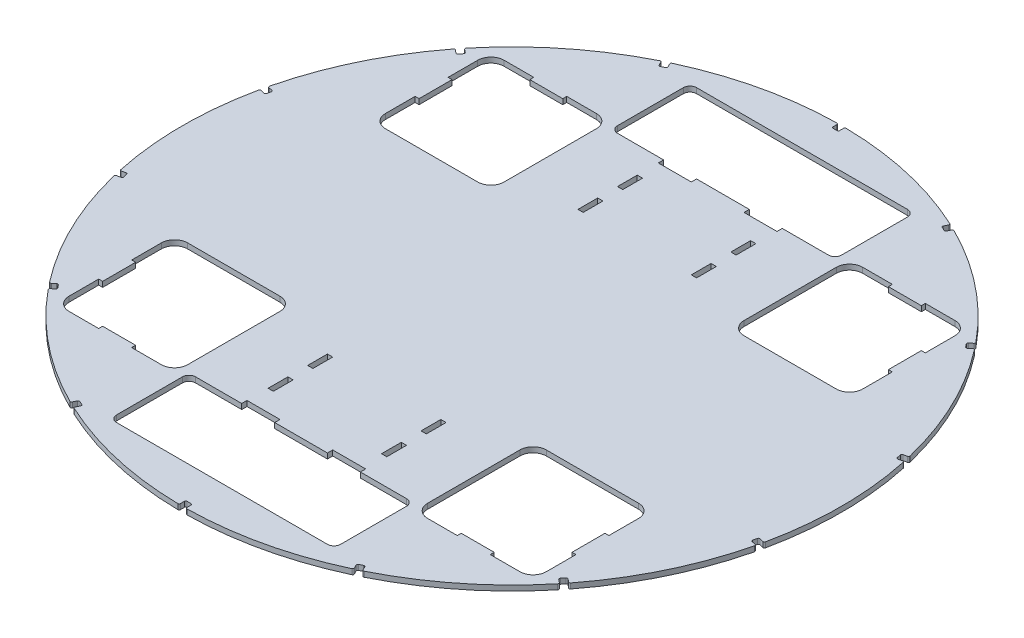
from build123d import *

# Parameters (mm, degrees)
SKETCH1_R                = 250
BOSS_EXTRUDE1_DEPTH      = 4
CUT_EXTRUDE1_DEPTH       = 10
SKETCH3_W                = 25
SKETCH3_H                = 4
CUT_EXTRUDE2_DEPTH       = 5
SKETCH4_W                = 4
SKETCH4_H                = 15
CUT_EXTRUDE3_DEPTH       = 20
CUT_EXTRUDE4_DEPTH       = 5
SKETCH8_W                = 6
SKETCH8_H                = 25
SKETCH8_W_2              = 25
SKETCH8_H_2              = 6
BOSS_EXTRUDE2_DEPTH      = 4
CUT_EXTRUDE5_DEPTH       = 4
FILLET1_R                = 1
CIRPATTERN1_COUNT        = 14
FILLET1_OF_CIRPATTERN1_R = 1


with BuildPart() as part:
    # Sketch1 → Boss-Extrude1 (new body)
    with BuildSketch(Plane(origin=(0, 0, 0), x_dir=(1, 0, 0), z_dir=(0, 1, 0))):
        Circle(SKETCH1_R)
    extrude(amount=BOSS_EXTRUDE1_DEPTH)

    # Sketch2 → Cut-Extrude1 (cut)
    with BuildSketch(Plane(origin=(0, 4, 0), x_dir=(1, 0, 0), z_dir=(0, 1, 0))):
        with BuildLine():
            Line((80, 220), (-80, 220))
            ThreePointArc((-80, 220), (-83.535533906, 218.535533906), (-85, 215))
            Line((-85, 215), (-85, 165))
            ThreePointArc((-85, 165), (-83.535533906, 161.464466094), (-80, 160))
            Line((-80, 160), (80, 160))
            ThreePointArc((80, 160), (83.535533906, 161.464466094), (85, 165))
            Line((85, 165), (85, 215))
            ThreePointArc((85, 215), (83.535533906, 218.535533906), (80, 220))
        make_face()
        with BuildLine():
            Line((85, -215), (85, -165))
            ThreePointArc((85, -165), (83.535533906, -161.464466094), (80, -160))
            Line((80, -160), (-80, -160))
            ThreePointArc((-80, -160), (-83.535533906, -161.464466094), (-85, -165))
            Line((-85, -165), (-85, -215))
            ThreePointArc((-85, -215), (-83.535533906, -218.535533906), (-80, -220))
            Line((-80, -220), (80, -220))
            ThreePointArc((80, -220), (83.535533906, -218.535533906), (85, -215))
        make_face()
    extrude(amount=-CUT_EXTRUDE1_DEPTH, mode=Mode.SUBTRACT)

    # Sketch3 → Cut-Extrude2 (cut)
    with BuildSketch(Plane(origin=(0, 4, 0), x_dir=(1, 0, 0), z_dir=(0, 1, 0))):
        with Locations((32.5, 158)):
            Rectangle(SKETCH3_W, SKETCH3_H)
        with Locations((-32.5, 158)):
            Rectangle(SKETCH3_W, SKETCH3_H)
        with Locations((-32.5, -158)):
            Rectangle(SKETCH3_W, SKETCH3_H)
        with Locations((32.5, -158)):
            Rectangle(SKETCH3_W, SKETCH3_H)
    extrude(amount=-CUT_EXTRUDE2_DEPTH, mode=Mode.SUBTRACT)

    # Sketch4 → Cut-Extrude3 (cut)
    with BuildSketch(Plane(origin=(0, 4, 0), x_dir=(1, 0, 0), z_dir=(0, 1, 0))):
        with Locations((43, 132.5)):
            Rectangle(SKETCH4_W, SKETCH4_H)
        with Locations((43, 102.5)):
            Rectangle(SKETCH4_W, SKETCH4_H)
        with Locations((-43, 102.5)):
            Rectangle(SKETCH4_W, SKETCH4_H)
        with Locations((-43, 132.5)):
            Rectangle(SKETCH4_W, SKETCH4_H)
        with Locations((-43, -132.5)):
            Rectangle(SKETCH4_W, SKETCH4_H)
        with Locations((-43, -102.5)):
            Rectangle(SKETCH4_W, SKETCH4_H)
        with Locations((43, -102.5)):
            Rectangle(SKETCH4_W, SKETCH4_H)
        with Locations((43, -132.5)):
            Rectangle(SKETCH4_W, SKETCH4_H)
    extrude(amount=-CUT_EXTRUDE3_DEPTH, mode=Mode.SUBTRACT)

    # Sketch7 → Cut-Extrude4 (cut)
    with BuildSketch(Plane(origin=(0, 4, 0), x_dir=(1, 0, 0), z_dir=(0, 1, 0))):
        with BuildLine():
            Line((-101, 75), (-171, 75))
            ThreePointArc((-171, 75), (-178.071067812, 77.928932188), (-181, 85))
            Line((-181, 85), (-181, 155))
            ThreePointArc((-181, 155), (-178.071067812, 162.071067812), (-171, 165))
            Line((-171, 165), (-101, 165))
            ThreePointArc((-101, 165), (-93.928932188, 162.071067812), (-91, 155))
            Line((-91, 155), (-91, 85))
            ThreePointArc((-91, 85), (-93.928932188, 77.928932188), (-101, 75))
        make_face()
        with BuildLine():
            Line((181, 85), (181, 155))
            ThreePointArc((181, 155), (178.071067812, 162.071067812), (171, 165))
            Line((171, 165), (101, 165))
            ThreePointArc((101, 165), (93.928932188, 162.071067812), (91, 155))
            Line((91, 155), (91, 85))
            ThreePointArc((91, 85), (93.928932188, 77.928932188), (101, 75))
            Line((101, 75), (171, 75))
            ThreePointArc((171, 75), (178.071067812, 77.928932188), (181, 85))
        make_face()
        with BuildLine():
            Line((101, -75), (171, -75))
            ThreePointArc((171, -75), (178.071067812, -77.928932188), (181, -85))
            Line((181, -85), (181, -155))
            ThreePointArc((181, -155), (178.071067812, -162.071067812), (171, -165))
            Line((171, -165), (101, -165))
            ThreePointArc((101, -165), (93.928932188, -162.071067812), (91, -155))
            Line((91, -155), (91, -85))
            ThreePointArc((91, -85), (93.928932188, -77.928932188), (101, -75))
        make_face()
        with BuildLine():
            Line((-181, -85), (-181, -155))
            ThreePointArc((-181, -155), (-178.071067812, -162.071067812), (-171, -165))
            Line((-171, -165), (-101, -165))
            ThreePointArc((-101, -165), (-93.928932188, -162.071067812), (-91, -155))
            Line((-91, -155), (-91, -85))
            ThreePointArc((-91, -85), (-93.928932188, -77.928932188), (-101, -75))
            Line((-101, -75), (-171, -75))
            ThreePointArc((-171, -75), (-178.071067812, -77.928932188), (-181, -85))
        make_face()
    extrude(amount=-CUT_EXTRUDE4_DEPTH, mode=Mode.SUBTRACT)

    # Sketch8 → Boss-Extrude2 (add)
    with BuildSketch(Plane(origin=(0, 4, 0), x_dir=(1, 0, 0), z_dir=(0, 1, 0))):
        with Locations((-181, 120)):
            Rectangle(SKETCH8_W, SKETCH8_H)
        with Locations((-136, 165)):
            Rectangle(SKETCH8_W_2, SKETCH8_H_2)
        with Locations((136, 165)):
            Rectangle(SKETCH8_W_2, SKETCH8_H_2)
        with Locations((181, 120)):
            Rectangle(SKETCH8_W, SKETCH8_H)
        with Locations((181, -120)):
            Rectangle(SKETCH8_W, SKETCH8_H)
        with Locations((136, -165)):
            Rectangle(SKETCH8_W_2, SKETCH8_H_2)
        with Locations((-136, -165)):
            Rectangle(SKETCH8_W_2, SKETCH8_H_2)
        with Locations((-181, -120)):
            Rectangle(SKETCH8_W, SKETCH8_H)
    extrude(amount=-BOSS_EXTRUDE2_DEPTH)

    # Sketch11 → Cut-Extrude5 (cut)
    with BuildSketch(Plane(origin=(0, 4, 0), x_dir=(1, 0, 0), z_dir=(0, 1, 0))):
        with BuildLine():
            Line((1.5, 245), (-1.5, 245))
            ThreePointArc((-1.5, 245), (-2.207106781, 245.292893219), (-2.5, 246))
            Line((-2.5, 246), (-2.5, 255))
            Line((-2.5, 255), (2.5, 255))
            Line((2.5, 255), (2.5, 246))
            ThreePointArc((2.5, 246), (2.207106781, 245.292893219), (1.5, 245))
        make_face()
    cut_extrude5 = extrude(amount=-CUT_EXTRUDE5_DEPTH, mode=Mode.SUBTRACT)

    # Fillet1
    fillet1_edges = [part.edges().sort_by_distance(p)[0] for p in [
        (2.5, 2, -249.987499687),
        (-2.5, 2, -249.987499687),
    ]]
    fillet(fillet1_edges, radius=FILLET1_R)

    # CirPattern1: Cut-Extrude5 ×14 about axis
    cirpattern1_axis = Axis((0, 4, 0), (0, -1, 0))
    for i in range(1, CIRPATTERN1_COUNT):
        add(cut_extrude5.rotate(cirpattern1_axis, i * 360 / CIRPATTERN1_COUNT), mode=Mode.SUBTRACT)

    # Fillet1 of CirPattern1
    fillet1_of_cirpattern1_edges = [part.edges().sort_by_distance(p)[0] for p in [
        (110.717933267, 2, -224.146245235),
        (106.213088927, 2, -226.315663931),
        (197.006821984, 2, -153.910077941),
        (193.889372974, 2, -157.819235353),
        (244.276093477, 2, -53.190132127),
        (243.163488807, 2, -58.064771688),
        (243.163488807, 2, 58.064771688),
        (244.276093477, 2, 53.190132127),
        (193.889372974, 2, 157.819235353),
        (197.006821984, 2, 153.910077941),
        (106.213088927, 2, 226.315663931),
        (110.717933267, 2, 224.146245235),
        (-2.5, 2, 249.987499687),
        (2.5, 2, 249.987499687),
        (-110.717933267, 2, 224.146245235),
        (-106.213088927, 2, 226.315663931),
        (-197.006821984, 2, 153.910077941),
        (-193.889372974, 2, 157.819235353),
        (-244.276093477, 2, 53.190132127),
        (-243.163488807, 2, 58.064771688),
        (-243.163488807, 2, -58.064771688),
        (-244.276093477, 2, -53.190132127),
        (-193.889372974, 2, -157.819235353),
        (-197.006821984, 2, -153.910077941),
        (-106.213088927, 2, -226.315663931),
        (-110.717933267, 2, -224.146245235),
    ]]
    fillet(fillet1_of_cirpattern1_edges, radius=FILLET1_OF_CIRPATTERN1_R)


solid = part.part
